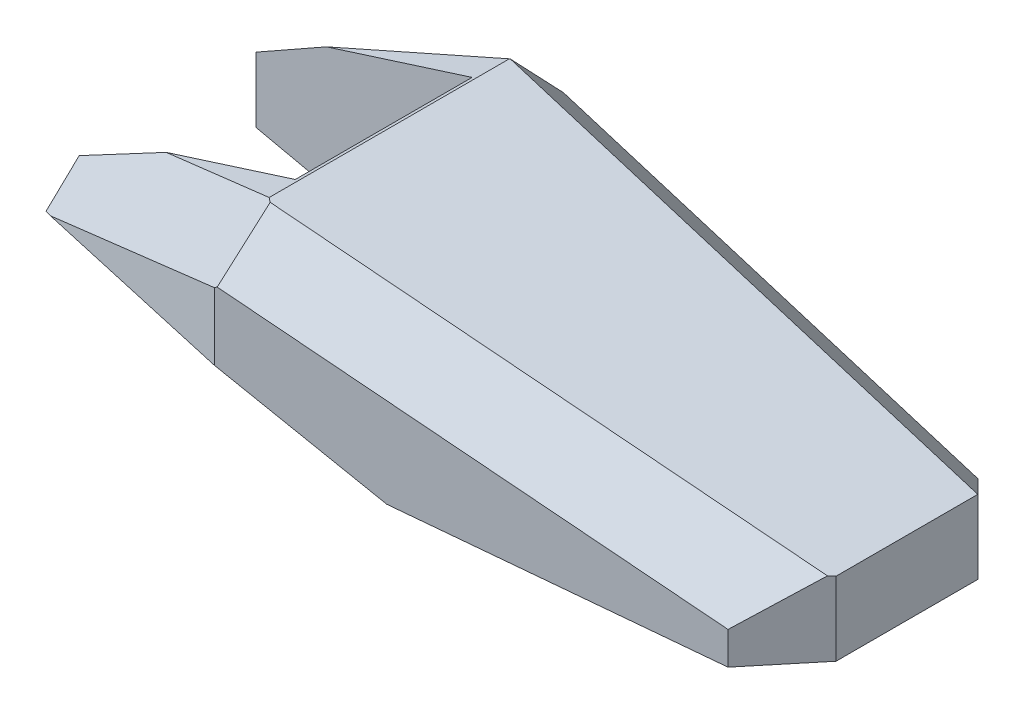
from build123d import *

# Parameters (mm, degrees)
BOSS_EXTRUDE1_DEPTH = 35
SKETCH3_W           = 44
SKETCH3_H           = 36
CUT_EXTRUDE1_DEPTH  = 90.567584934
CHAMFER1_SIZE       = 10
CHAMFER1_SIZE_2     = 11.096755526
CHAMFER1_SIZE2      = 10.174134289
CHAMFER1_SIZE2_2    = 10.73729935


with BuildPart() as part:
    # Sketch1 → Boss-Extrude1 (new, symmetric)
    with BuildSketch(Plane.XY):
        Polygon((75, 0), (-75, 0), (-75, 20), (-30.241576831, 34.239630123), (75, 15), align=None)
    extrude(amount=BOSS_EXTRUDE1_DEPTH, both=True)

    # Sketch3 → Cut-Extrude1 (cut, through all)
    with BuildSketch(Plane.XZ):
        Polygon((-30.49, 35), (75, 25), (75, 35), align=None)
        Polygon((75, -35), (75, -25), (-30.49, -35), align=None)
        with Locations((-53, 0)):
            Rectangle(SKETCH3_W, SKETCH3_H)
        Polygon((-75, 25), (-30.49, 35), (-75, 35), align=None)
        Polygon((-75, -35), (-30.49, -35), (-75, -25), align=None)
    extrude(amount=-CUT_EXTRUDE1_DEPTH, mode=Mode.SUBTRACT)

    # Chamfer1
    chamfer1_edges = [part.edges().sort_by_distance(p)[0] for p in [
        (-52.745, 0, 30),
    ]]
    chamfer(chamfer1_edges, length=CHAMFER1_SIZE)
    chamfer1_2_edges = [part.edges().sort_by_distance(p)[0] for p in [
        (-52.745, 0, -30),
    ]]
    chamfer(chamfer1_2_edges, length=CHAMFER1_SIZE)
    chamfer1_3_edges = [part.edges().sort_by_distance(p)[0] for p in [
        (75, 7.5, 25),
    ]]
    chamfer1_3_side = [part.faces().sort_by_distance(p)[0] for p in [
        (75, 7.5, 24.8),
    ]]
    chamfer(chamfer1_3_edges, length=CHAMFER1_SIZE_2, length2=CHAMFER1_SIZE, reference=chamfer1_3_side[0])
    chamfer1_4_edges = [part.edges().sort_by_distance(p)[0] for p in [
        (75, 7.5, -25),
    ]]
    chamfer1_4_side = [part.faces().sort_by_distance(p)[0] for p in [
        (75, 7.5, -24.8),
    ]]
    chamfer(chamfer1_4_edges, length=CHAMFER1_SIZE, length2=CHAMFER1_SIZE_2, reference=chamfer1_4_side[0])
    chamfer1_5_edges = [part.edges().sort_by_distance(p)[0] for p in [
        (17.401526868, 25.52980535, 30.460088457),
    ]]
    chamfer1_5_side = [part.faces().sort_by_distance(p)[0] for p in [
        (17.365875348, 25.3330376, 30.463468068),
    ]]
    chamfer(chamfer1_5_edges, length=CHAMFER1_SIZE, length2=CHAMFER1_SIZE2, reference=chamfer1_5_side[0])
    chamfer1_6_edges = [part.edges().sort_by_distance(p)[0] for p in [
        (-58.87630634, 25.129658681, 28.622487904),
    ]]
    chamfer1_6_side = [part.faces().sort_by_distance(p)[0] for p in [
        (-58.818457754, 24.938649191, 28.635484665),
    ]]
    chamfer(chamfer1_6_edges, length=CHAMFER1_SIZE, length2=CHAMFER1_SIZE2_2, reference=chamfer1_6_side[0])
    chamfer1_7_edges = [part.edges().sort_by_distance(p)[0] for p in [
        (-52.745, 27.080297874, -30),
    ]]
    chamfer1_7_side = [part.faces().sort_by_distance(p)[0] for p in [
        (-52.705100441, 27.092991685, -29.804431873),
    ]]
    chamfer(chamfer1_7_edges, length=CHAMFER1_SIZE, length2=CHAMFER1_SIZE2_2, reference=chamfer1_7_side[0])
    chamfer1_8_edges = [part.edges().sort_by_distance(p)[0] for p in [
        (23.400963602, 24.433024522, -29.891367561),
    ]]
    chamfer1_8_side = [part.faces().sort_by_distance(p)[0] for p in [
        (23.382696848, 24.43636394, -29.692231492),
    ]]
    chamfer(chamfer1_8_edges, length=CHAMFER1_SIZE, length2=CHAMFER1_SIZE2, reference=chamfer1_8_side[0])


solid = part.part
